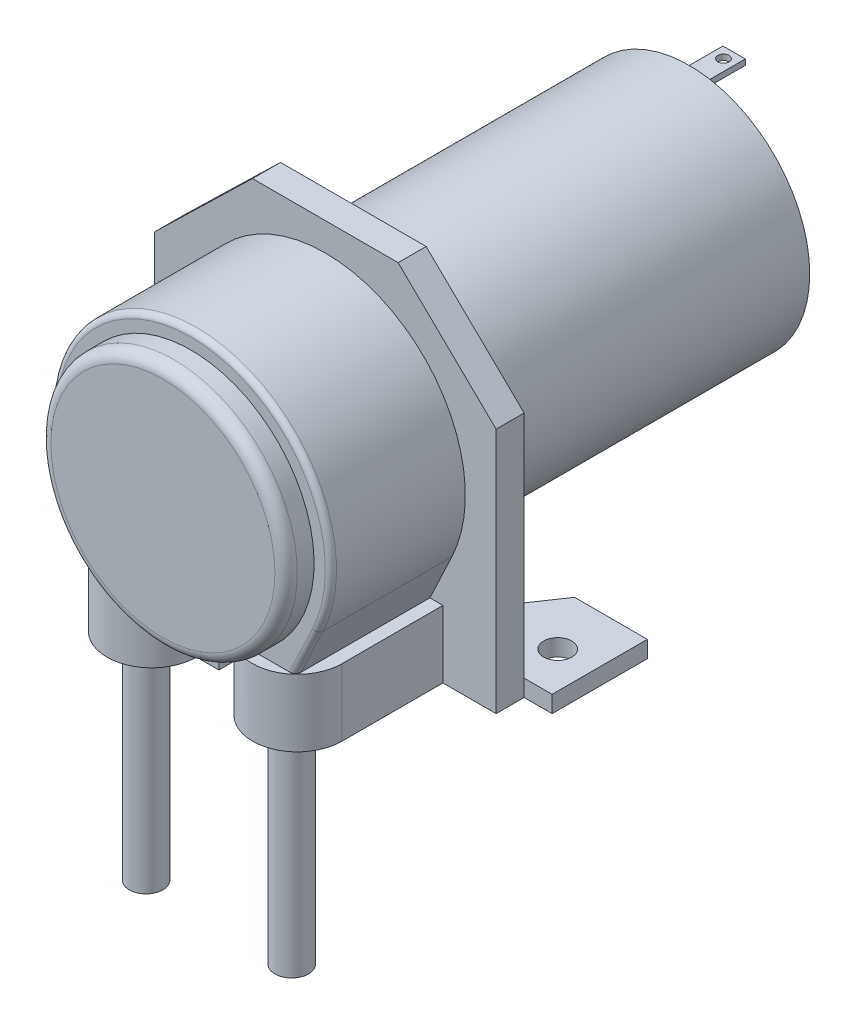
from build123d import *
from build123d.topology import SkipClean

# Parameters (mm, degrees)
BOSS_EXTRUDE1_DEPTH = 3.175
SKETCH2_W           = 10.16
SKETCH2_H           = 7.62
BOSS_EXTRUDE2_DEPTH = 11.43
SKETCH3_W           = 5.08
SKETCH3_H           = 7.62
REVOLVE1_ANGLE      = 180
SKETCH4_W           = 5.08
SKETCH4_H           = 7.62
REVOLVE2_ANGLE      = 180
BOSS_EXTRUDE3_DEPTH = 15.24
SKETCH6_R           = 13.97
BOSS_EXTRUDE4_DEPTH = 3.175
FILLET1_R           = 1.27
FILLET2_R           = 0.635
BOSS_EXTRUDE5_DEPTH = 1.905
SKETCH9_R           = 1.5875
CUT_EXTRUDE1_DEPTH  = 50.746282631
CUT_EXTRUDE2_DEPTH  = 1.27
SKETCH10_R          = 1.905
BOSS_EXTRUDE6_DEPTH = 25.4
SKETCH12_R          = 13.6525
BOSS_EXTRUDE7_DEPTH = 38.1
SKETCH13_R          = 3.175
BOSS_EXTRUDE8_DEPTH = 2.54
SKETCH14_W          = 2.54
SKETCH14_H          = 0.635
BOSS_EXTRUDE9_DEPTH = 5.08
SKETCH15_R          = 0.635
CUT_EXTRUDE3_DEPTH  = 58.971361572


with BuildPart() as part:
    # Sketch1 → Boss-Extrude1 (new body)
    with BuildSketch(Plane.XY):
        Polygon((-19.3675, 27.94), (-19.3675, 0), (19.3675, 0), (19.3675, 27.94), (8.255, 38.735), (-8.255, 38.735), align=None)
    extrude(amount=BOSS_EXTRUDE1_DEPTH)

    # Sketch2 → Boss-Extrude2 (add)
    with BuildSketch(Plane.XY.offset(3.175)):
        with Locations((-8.255, 3.81)):
            Rectangle(SKETCH2_W, SKETCH2_H)
        with Locations((8.255, 3.81)):
            Rectangle(SKETCH2_W, SKETCH2_H)
    extrude(amount=BOSS_EXTRUDE2_DEPTH)

    # Sketch3 → Revolve1 (revolve)
    with SkipClean():  # the faces are left unmerged after this step: merging them gives an invalid solid
        with BuildSketch(Plane.XY.offset(14.605)):
            with Locations((-5.715, 3.81)):
                Rectangle(SKETCH3_W, SKETCH3_H)
            with Locations((-10.795, 3.81)):
                Rectangle(SKETCH3_W, SKETCH3_H)
        revolve(axis=Axis((-8.255, 7.62, 14.605), (0, -1, 0)), revolution_arc=REVOLVE1_ANGLE)
    add(part.part.scale(1), mode=Mode.REPLACE)  # the faces are merged on a copy

    # Sketch4 → Revolve2 (revolve)
    with BuildSketch(Plane.XY.offset(14.605)):
        with Locations((5.715, 3.81)):
            Rectangle(SKETCH4_W, SKETCH4_H)
    revolve(axis=Axis((8.255, 7.62, 14.605), (0, 1, 0)), revolution_arc=REVOLVE2_ANGLE)

    # Sketch5 → Boss-Extrude3 (add)
    with BuildSketch(Plane.XY.offset(3.175)):
        with BuildLine():
            ThreePointArc((14.352662754, 12.90143922), (0, 35.56), (-14.352662754, 12.90143922))
            Line((-14.352662754, 12.90143922), (-11.856473401, 7.62))
            Line((-11.856473401, 7.62), (-3.175, 7.62))
            Line((-3.175, 7.62), (-3.175, 3.81))
            Line((-3.175, 3.81), (3.175, 3.81))
            Line((3.175, 3.81), (3.175, 7.62))
            Line((3.175, 7.62), (11.856473401, 7.62))
            Line((11.856473401, 7.62), (14.352662754, 12.90143922))
        make_face()
    extrude(amount=BOSS_EXTRUDE3_DEPTH)

    # Sketch6 → Boss-Extrude4 (add)
    with BuildSketch(Plane.XY.offset(18.415)):
        with Locations(Location((0, 19.685, 0), (0, 0, 239.727358681))):
            Circle(SKETCH6_R)
    extrude(amount=BOSS_EXTRUDE4_DEPTH)

    # Fillet1
    fillet1_edges = [part.edges().sort_by_distance(p)[0] for p in [
        (7.042490682, 31.75, 21.59),
    ]]
    fillet(fillet1_edges, radius=FILLET1_R)

    # Fillet2
    # the kernel refuses this fillet: 0.635 mm, written as the material it takes off along each edge
    with BuildSketch(Plane(origin=(11.178117323, 6.184733725, 18.415), x_dir=(-0.9041047404261693, 0.4273109153051544, 0), z_dir=(0.42731091530515436, 0.9041047404261694, 0))) as fillet2_piece_1_section:
        with BuildLine():
            CenterArc((FILLET2_R, -FILLET2_R), FILLET2_R, 90, 90)
            Line((0, -FILLET2_R), (0, 0))
            Line((0, 0), (FILLET2_R, 0))
        make_face()
    fillet2_piece_1 = extrude(amount=7.429123192, mode=Mode.PRIVATE)
    fillet2_piece_1 = split(fillet2_piece_1, bisect_by=Plane(origin=(12.958569615, 7.62, 18.272124555), z_dir=(0, 1, 0)), keep=Keep.TOP, mode=Mode.PRIVATE)
    add(fillet2_piece_1, mode=Mode.SUBTRACT)
    with BuildSketch(Plane(origin=(0, 19.685, 18.415), x_dir=(0.9041047404261693, -0.42731091530515447, 0), z_dir=(-0.42731091530515447, -0.9041047404261693, 0))) as fillet2_piece_2:
        with BuildLine():
            CenterArc((15.875 - FILLET2_R, -FILLET2_R), FILLET2_R, 0, 90)
            Line((15.875, -FILLET2_R), (15.875, 0))
            Line((15.875, 0), (15.875 - FILLET2_R, 0))
        make_face()
    revolve(axis=Axis((0, 19.685, 18.415), (0, 0, 1)), revolution_arc=230.594049451, mode=Mode.SUBTRACT)
    with BuildSketch(Plane(origin=(-14.352662754, 12.90143922, 18.415), x_dir=(0.9041047404261693, 0.4273109153051546, 0), z_dir=(0.4273109153051546, -0.9041047404261694, 0))) as fillet2_piece_3_section:
        with BuildLine():
            CenterArc((FILLET2_R, -FILLET2_R), FILLET2_R, 90, 90)
            Line((0, -FILLET2_R), (0, 0))
            Line((0, 0), (FILLET2_R, 0))
        make_face()
    fillet2_piece_3 = extrude(amount=7.429123192, mode=Mode.PRIVATE)
    fillet2_piece_3 = split(fillet2_piece_3, bisect_by=Plane(origin=(-12.958569615, 7.62, 18.272124555), z_dir=(0, 1, 0)), keep=Keep.TOP, mode=Mode.PRIVATE)
    add(fillet2_piece_3, mode=Mode.SUBTRACT)

    # Sketch8 → Boss-Extrude5 (add)
    with BuildSketch(Plane.XZ):
        Polygon((-22.5425, 0), (-22.5425, -10.795), (-14.2875, -10.795), (-6.985, 0), align=None)
        Polygon((22.5425, -10.795), (14.2875, -10.795), (6.985, 0), (22.5425, 0), align=None)
    extrude(amount=-BOSS_EXTRUDE5_DEPTH)

    # Sketch9 → Cut-Extrude1 (cut, through all)
    with BuildSketch(Plane.XZ):
        with Locations(Location((18.415, -4.7625, 0), (0, 0, 270))):
            Circle(SKETCH9_R)
        with Locations(Location((-18.415, -4.7625, 0), (0, 0, 270))):
            Circle(SKETCH9_R)
    extrude(amount=-CUT_EXTRUDE1_DEPTH, mode=Mode.SUBTRACT)

    # Sketch11 → Cut-Extrude2 (cut)
    with BuildSketch(Plane.XZ):
        with BuildLine():
            Line((-11.43, 6.985), (-5.08, 6.985))
            Line((-5.08, 6.985), (-5.08, 14.605))
            ThreePointArc((-5.08, 14.605), (-8.255, 17.78), (-11.43, 14.605))
            Line((-11.43, 14.605), (-11.43, 6.985))
        make_face()
        with BuildLine():
            Line((11.43, 14.605), (11.43, 6.985))
            Line((11.43, 6.985), (5.08, 6.985))
            Line((5.08, 6.985), (5.08, 14.605))
            ThreePointArc((5.08, 14.605), (8.255, 17.78), (11.43, 14.605))
        make_face()
    extrude(amount=-CUT_EXTRUDE2_DEPTH, mode=Mode.SUBTRACT)

    # Sketch10 → Boss-Extrude6 (add)
    with BuildSketch(Plane.XZ.offset(-1.27)):
        with Locations(Location((-8.255, 15.24, 0), (0, 0, 270))):
            Circle(SKETCH10_R)
        with Locations(Location((8.255, 15.24, 0), (0, 0, 90))):
            Circle(SKETCH10_R)
    extrude(amount=BOSS_EXTRUDE6_DEPTH)

    # Sketch12 → Boss-Extrude7 (add)
    with BuildSketch(Plane(origin=(0, 0, 0), x_dir=(-1, 0, 0), z_dir=(0, 0, -1))):
        with Locations(Location((0, 19.685, 0), (0, 0, 180))):
            Circle(SKETCH12_R)
    extrude(amount=BOSS_EXTRUDE7_DEPTH)

    # Sketch13 → Boss-Extrude8 (add)
    with BuildSketch(Plane(origin=(0, 0, -38.1), x_dir=(-1, 0, 0), z_dir=(0, 0, -1))):
        with Locations((0, 19.685)):
            Circle(SKETCH13_R)
    extrude(amount=BOSS_EXTRUDE8_DEPTH)

    # Sketch14 → Boss-Extrude9 (add)
    with BuildSketch(Plane(origin=(0, 0, -38.1), x_dir=(-1, 0, 0), z_dir=(0, 0, -1))):
        with Locations((0, 31.75)):
            Rectangle(SKETCH14_W, SKETCH14_H)
        with Locations((0, 7.62)):
            Rectangle(SKETCH14_W, SKETCH14_H)
    extrude(amount=BOSS_EXTRUDE9_DEPTH)

    # Sketch15 → Cut-Extrude3 (cut, through all)
    with BuildSketch(Plane.XZ.offset(-7.3025)):
        with Locations((0, -41.96981375)):
            Circle(SKETCH15_R)
    extrude(amount=-CUT_EXTRUDE3_DEPTH, mode=Mode.SUBTRACT)


solid = part.part
